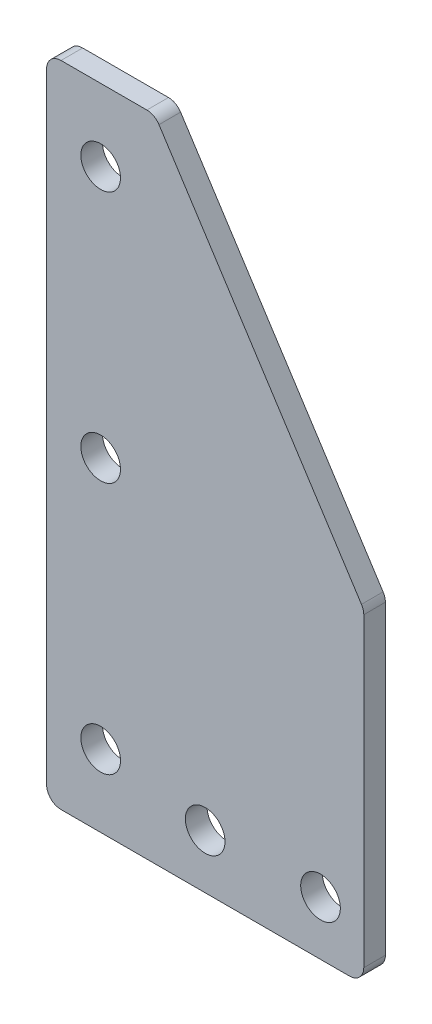
from build123d import *

# Parameters (mm, degrees)
BOSS_EXTRU_1_DEPTH           = 3
ENL_V_MAT_EXTRU_1_DEPTH      = 101.224747443
ENL_V_MAT_EXTRU_1_DEPTH_BACK = 101.224747443
ESQUISSE2_R                  = 2.75
CONG_1_R                     = 2


with BuildPart() as part:
    # Esquisse1 → Boss.-Extru.1 (new body)
    with BuildSketch(Plane.XY):
        Polygon((0, 0), (44, 0), (44, 45), (15, 90), (0, 90), align=None)
    extrude(amount=BOSS_EXTRU_1_DEPTH)

    # Esquisse2 → Enlèv. mat.-Extru.1 (cut, two sides: drawn at the far end of the back side and taken through both)
    with BuildSketch(Plane.XY.offset(3).offset(-ENL_V_MAT_EXTRU_1_DEPTH_BACK)):
        with Locations((7.5, 10)):
            Circle(ESQUISSE2_R)
        with Locations((7.5, 45)):
            Circle(ESQUISSE2_R)
        with Locations((7.5, 80)):
            Circle(ESQUISSE2_R)
        with Locations((22, 7.5)):
            Circle(ESQUISSE2_R)
        with Locations((38, 7.5)):
            Circle(ESQUISSE2_R)
    extrude(amount=ENL_V_MAT_EXTRU_1_DEPTH + ENL_V_MAT_EXTRU_1_DEPTH_BACK, mode=Mode.SUBTRACT)

    # Congé1
    cong_1_edges = [part.edges().sort_by_distance(p)[0] for p in [
        (44, 0, 1.5),
        (0, 0, 1.5),
        (15, 90, 1.5),
        (0, 90, 1.5),
        (44, 45, 1.5),
    ]]
    fillet(cong_1_edges, radius=CONG_1_R)


solid = part.part
